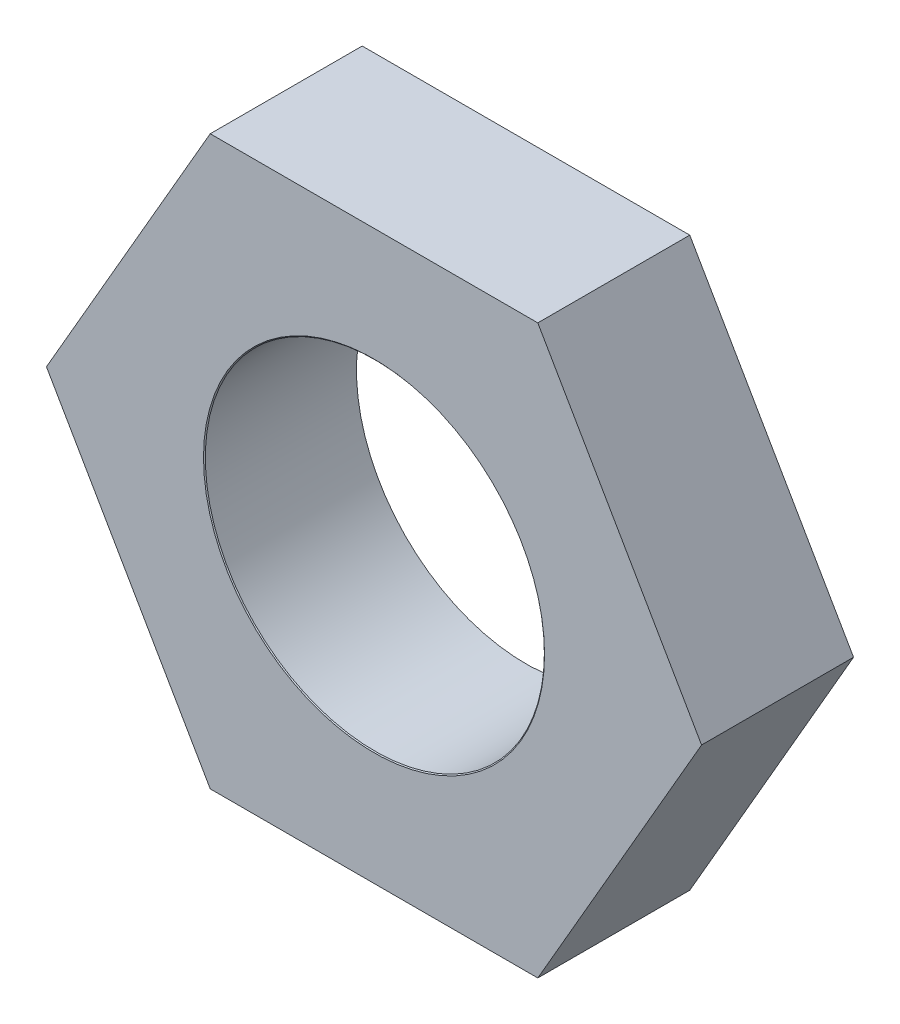
from build123d import *

# Parameters (mm, degrees)
BOSS_EXTRUDE1_DEPTH                    = 3.81
TAP_DRILL_FOR_M10X1_5_TAP1_D           = 8.5
TAP_DRILL_FOR_M10X1_5_TAP1_CSINK_D     = 8.55
TAP_DRILL_FOR_M10X1_5_TAP1_CSINK_ANGLE = 100


with BuildPart() as part:
    # Sketch1 → Boss-Extrude1 (new body)
    with BuildSketch(Plane(origin=(0, 0, 0), x_dir=(0, 1, 0), z_dir=(0, 0, 1))):
        Polygon((7.112, 4.106115114), (0, 8.212230229), (-7.112, 4.106115114), (-7.112, -4.106115114), (0, -8.212230229), (7.112, -4.106115114), align=None)
    extrude(amount=BOSS_EXTRUDE1_DEPTH)

    # Tap Drill for M10x1.5 Tap1 (through all)
    with Locations(Plane.XY.offset(3.81)):
        with Locations((0, 0)):
            CounterSinkHole(TAP_DRILL_FOR_M10X1_5_TAP1_D / 2, TAP_DRILL_FOR_M10X1_5_TAP1_CSINK_D / 2, counter_sink_angle=TAP_DRILL_FOR_M10X1_5_TAP1_CSINK_ANGLE)


solid = part.part
